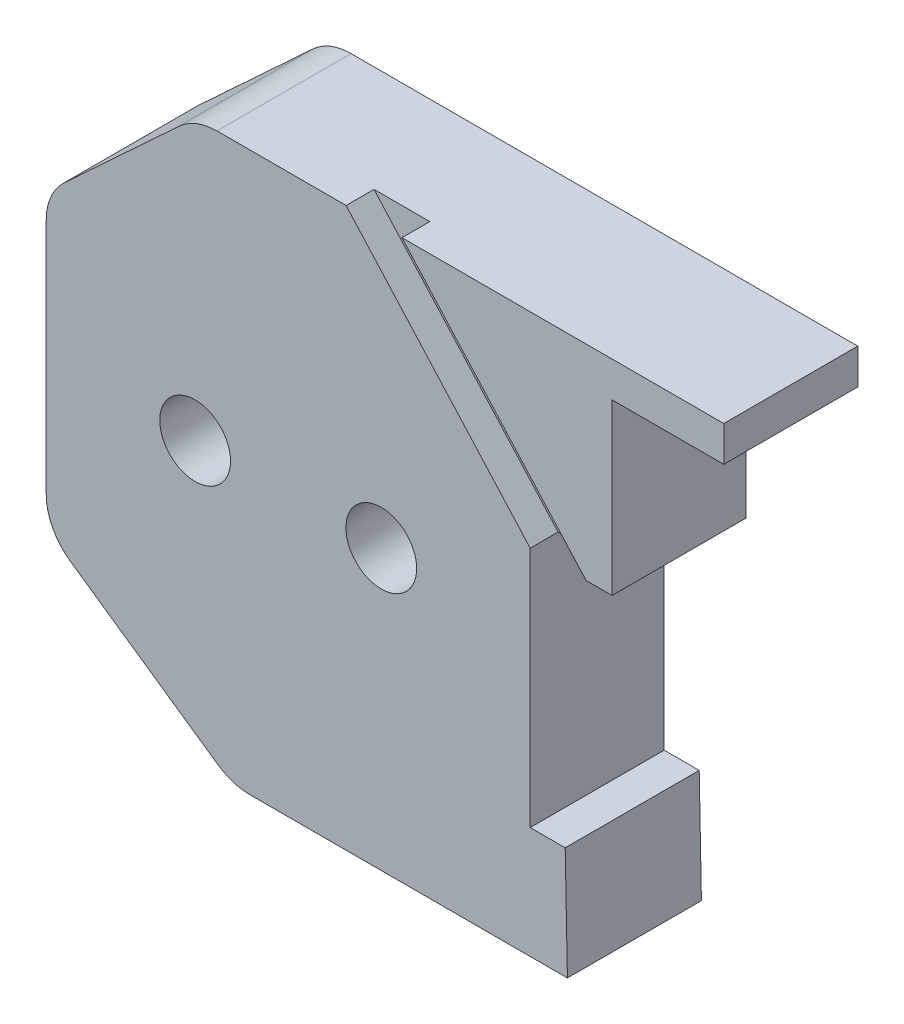
from build123d import *

# Parameters (mm, degrees)
BOSS_EXTRUDE1_DEPTH = 2
BOSS_EXTRUDE2_DEPTH = 8
SKETCH24_R          = 3.9
BOSS_EXTRUDE5_DEPTH = 4.4
SKETCH30_W          = 4.40861202
SKETCH30_H          = 1.324178481
CUT_EXTRUDE12_DEPTH = 16
CUT_EXTRUDE11_DEPTH = 23.928148639
FILLET1_R           = 1.5
SKETCH34_W          = 1.5
SKETCH34_H          = 1.5
CUT_EXTRUDE13_DEPTH = 8
SKETCH36_R          = 0.95
CUT_EXTRUDE15_DEPTH = 8
SKETCH37_R          = 2
CUT_EXTRUDE16_DEPTH = 4.5
SKETCH38_W          = 3
SKETCH38_H          = 1.25
CUT_EXTRUDE17_DEPTH = 3.6


with BuildPart() as part:
    # Sketch2 → Boss-Extrude1 (new body)
    with BuildSketch(Plane.XY):
        with BuildLine():
            Line((-2.5, 7.5), (-16.7, 7.5))
            Line((-16.7, 7.5), (-20.7, 3.793442666))
            Line((-20.7, 3.793442666), (-20.7, -4.031648778))
            Line((-20.7, -4.031648778), (-15.7, -7.5))
            Line((-15.7, -7.5), (-6.7, -7.5))
            Line((-6.7, -7.5), (-4.2, -5.6))
            ThreePointArc((-4.2, -5.6), (3.130495168, -6.260990337), (7, 0))
            ThreePointArc((7, 0), (4.949747468, 4.949747468), (0, 7))
            Line((0, 7), (0, 7.5))
            Line((0, 7.5), (-2.5, 7.5))
        make_face()
    extrude(amount=BOSS_EXTRUDE1_DEPTH)

    # Sketch4 → Boss-Extrude2 (add)
    with BuildSketch(Plane.XY.offset(2)):
        Polygon((-15.7, -7.5), (-6.7, -7.5), (-6.759079174, -4.5), (-7.7, -4.5), (-7.7, 2), (-5.5, 2), (-5.5, 5.3), (-2.5, 5.3), (-2.5, 7.5), (-16.7, 7.5), (-20.7, 3.793442666), (-20.7, -4.031648778), align=None)
    extrude(amount=BOSS_EXTRUDE2_DEPTH)

    # Sketch24 → Boss-Extrude5 (add)
    with BuildSketch(Plane.XY.offset(2)):
        Circle(SKETCH24_R)
    extrude(amount=BOSS_EXTRUDE5_DEPTH)

    # Sketch30 → Cut-Extrude12 (cut)
    with BuildSketch(Plane(origin=(-5.5, 0, 0), x_dir=(0, 0, -1), z_dir=(1, 0, 0))):
        with Locations((-4.20430601, 4.63791076)):
            Rectangle(SKETCH30_W, SKETCH30_H)
    extrude(amount=-CUT_EXTRUDE12_DEPTH, mode=Mode.SUBTRACT)

    # Sketch28 → Cut-Extrude11 (cut, through all)
    with BuildSketch(Plane.XY.offset(6.4)):
        with BuildLine():
            Line((-1, 0.979795897), (-1, -0.979795897))
            ThreePointArc((-1, -0.979795897), (1.4, 0), (-1, 0.979795897))
        make_face()
    extrude(amount=-CUT_EXTRUDE11_DEPTH, mode=Mode.SUBTRACT)

    # Fillet1
    # the kernel refuses this fillet: 1.5 mm, written as the material it takes off along each edge
    with BuildSketch(Plane(origin=(-15.230677435, -6, 1.5), x_dir=(-0.5699665637840448, -0.8216678867816415, 0), z_dir=(0, 0, -1))) as fillet1_piece_1_section:
        Polygon((0, 0), (FILLET1_R * 1.02, 0), (FILLET1_R * 1.02, -FILLET1_R * 0.319139344377), (FILLET1_R * 0.838101244517, -FILLET1_R * 0.58136589506), align=None)
    fillet1_piece_1 = extrude(amount=FILLET1_R * 1.02, mode=Mode.PRIVATE)
    fillet1_piece_1 = fillet1_piece_1 - Plane(origin=(-15.230677435, -6, 1.5), x_dir=(0.29860685961507855, 0.9543762064253388, 0), z_dir=(0, 0, -1)) * Sphere(FILLET1_R, mode=Mode.PRIVATE)
    add(fillet1_piece_1, mode=Mode.SUBTRACT)
    with BuildSketch(Plane(origin=(-16.11186344, 6, 1.5), x_dir=(-0.6796897201843015, 0.7334997506991983, 0), z_dir=(0, 0, -1))) as fillet1_piece_2_section:
        Polygon((0, 0), (FILLET1_R * 1.02, 0), (FILLET1_R * 1.02, FILLET1_R * 0.399932860855), (FILLET1_R * 0.748169745713, FILLET1_R * 0.693283514588), align=None)
    fillet1_piece_2 = extrude(amount=FILLET1_R * 1.02, mode=Mode.PRIVATE)
    fillet1_piece_2 = fillet1_piece_2 - Plane(origin=(-16.11186344, 6, 1.5), x_dir=(0.3650344157067945, -0.9309940254102596, 0), z_dir=(0, 0, -1)) * Sphere(FILLET1_R, mode=Mode.PRIVATE)
    add(fillet1_piece_2, mode=Mode.SUBTRACT)
    with BuildSketch(Plane(origin=(-19.2, 3.138411196, 1.5), x_dir=(-0.6796897201843015, 0.7334997506991983, 0), z_dir=(0, 0, -1))) as fillet1_piece_3_section:
        Polygon((0, 0), (FILLET1_R * 1.02, 0), (FILLET1_R * 1.02, -FILLET1_R * 0.445421399395), (FILLET1_R * 0.693283514588, -FILLET1_R * 0.748169745713), align=None)
    fillet1_piece_3 = extrude(amount=FILLET1_R * 1.02, mode=Mode.PRIVATE)
    fillet1_piece_3 = fillet1_piece_3 - Plane(origin=(-19.2, 3.138411196, 1.5), x_dir=(0.9164304993244992, -0.40019387789901173, 0), z_dir=(0, 0, -1)) * Sphere(FILLET1_R, mode=Mode.PRIVATE)
    add(fillet1_piece_3, mode=Mode.SUBTRACT)
    with BuildSketch(Plane(origin=(-19.2, -3.246599046, 1.5), x_dir=(-0.5699665637840448, -0.8216678867816415, 0), z_dir=(0, 0, -1))) as fillet1_piece_4_section:
        Polygon((0, 0), (FILLET1_R * 1.02, 0), (FILLET1_R * 1.02, FILLET1_R * 0.533833817771), (FILLET1_R * 0.58136589506, FILLET1_R * 0.838101244517), align=None)
    fillet1_piece_4 = extrude(amount=FILLET1_R * 1.02, mode=Mode.PRIVATE)
    fillet1_piece_4 = fillet1_piece_4 - Plane(origin=(-19.2, -3.246599046, 1.5), x_dir=(0.8859928227090906, 0.46369895202380795, 0), z_dir=(0, 0, -1)) * Sphere(FILLET1_R, mode=Mode.PRIVATE)
    add(fillet1_piece_4, mode=Mode.SUBTRACT)
    with BuildSketch(Plane(origin=(-15.230677435, -7.5, 0), x_dir=(0, 1, 0), z_dir=(1, 0, 0))) as fillet1_piece_5_section:
        with BuildLine():
            CenterArc((FILLET1_R, FILLET1_R), FILLET1_R, 180, 90)
            Line((0, FILLET1_R), (0, 0))
            Line((0, 0), (FILLET1_R, 0))
        make_face()
    fillet1_piece_5 = extrude(amount=12.280677435, mode=Mode.PRIVATE)
    fillet1_piece_5 = split(fillet1_piece_5, bisect_by=Plane(origin=(-9.092127217, -9.318016685, 0.3282266), z_dir=(-0.6050832675335577, 0.7961621941231027, 0)), keep=Keep.TOP, mode=Mode.PRIVATE)
    add(fillet1_piece_5, mode=Mode.SUBTRACT)
    with BuildSketch(Plane(origin=(3.75, 7.5, 0), x_dir=(0, 0, 1), z_dir=(-1, 0, 0))) as fillet1_piece_6:
        with BuildLine():
            CenterArc((FILLET1_R, -FILLET1_R), FILLET1_R, 90, 90)
            Line((0, -FILLET1_R), (0, 0))
            Line((0, 0), (FILLET1_R, 0))
        make_face()
    extrude(amount=19.86186344, mode=Mode.SUBTRACT)
    with BuildSketch(Plane(origin=(-17.13139802, 7.100249626, 0), x_dir=(0.6796897201843014, -0.7334997506991981, 0), z_dir=(-0.7334997506991983, -0.6796897201843015, 0))) as fillet1_piece_7:
        with BuildLine():
            CenterArc((FILLET1_R, FILLET1_R), FILLET1_R, 180, 90)
            Line((0, FILLET1_R), (0, 0))
            Line((0, 0), (FILLET1_R, 0))
        make_face()
    extrude(amount=4.21013989, mode=Mode.SUBTRACT)
    with BuildSketch(Plane(origin=(-20.054949846, -4.479100876, 0), x_dir=(0.5699665637840448, 0.8216678867816416, 0), z_dir=(0.8216678867816415, -0.5699665637840448, 0))) as fillet1_piece_8:
        with BuildLine():
            CenterArc((FILLET1_R, FILLET1_R), FILLET1_R, 180, 90)
            Line((0, FILLET1_R), (0, 0))
            Line((0, 0), (FILLET1_R, 0))
        make_face()
    extrude(amount=4.830811364, mode=Mode.SUBTRACT)
    with BuildSketch(Plane(origin=(-20.7, 3.138411196, 0), x_dir=(1, 0, 0), z_dir=(0, -1, 0))) as fillet1_piece_9:
        with BuildLine():
            CenterArc((FILLET1_R, FILLET1_R), FILLET1_R, 180, 90)
            Line((0, FILLET1_R), (0, 0))
            Line((0, 0), (FILLET1_R, 0))
        make_face()
    extrude(amount=6.385010242, mode=Mode.SUBTRACT)
    with BuildSketch(Plane(origin=(-15.7, -7.5, 1.5), x_dir=(1, 0, 0), z_dir=(0, 0, 1))) as fillet1_piece_10:
        with BuildLine():
            CenterArc((FILLET1_R * 0.312881710173, FILLET1_R), FILLET1_R, 235.252105822, 34.747894178)
            Line((-FILLET1_R * 0.257084853611, FILLET1_R * 0.178332113218), (0, 0))
            Line((0, 0), (FILLET1_R * 0.312881710173, 0))
        make_face()
    extrude(amount=9.673306413, mode=Mode.SUBTRACT)
    with BuildSketch(Plane(origin=(-20.7, -4.031648778, 1.5), x_dir=(0, 1, 0), z_dir=(0, 0, 1))) as fillet1_piece_11:
        with BuildLine():
            CenterArc((FILLET1_R * 0.523366488011, -FILLET1_R), FILLET1_R, 90, 55.252105822)
            Line((-FILLET1_R * 0.298301398771, -FILLET1_R * 0.430033436216), (0, 0))
            Line((0, 0), (FILLET1_R * 0.523366488011, 0))
        make_face()
    extrude(amount=10.46262433, mode=Mode.SUBTRACT)
    with BuildSketch(Plane(origin=(-20.7, 3.793442666, 1.5), x_dir=(0.7334997506991984, 0.6796897201843014, 0), z_dir=(0, 0, 1))) as fillet1_piece_12:
        with BuildLine():
            CenterArc((FILLET1_R * 0.436687646465, -FILLET1_R), FILLET1_R, 90, 47.18059856)
            Line((-FILLET1_R * 0.296812104234, -FILLET1_R * 0.320310279816), (0, 0))
            Line((0, 0), (FILLET1_R * 0.436687646465, 0))
        make_face()
    extrude(amount=10.137578674, mode=Mode.SUBTRACT)
    with BuildSketch(Plane(origin=(-16.7, 7.5, 1.5), x_dir=(1, 0, 0), z_dir=(0, 0, 1))) as fillet1_piece_13:
        with BuildLine():
            CenterArc((FILLET1_R * 0.392091040054, -FILLET1_R), FILLET1_R, 90, 42.81940144)
            Line((-FILLET1_R * 0.287598680131, -FILLET1_R * 0.266500249301), (0, 0))
            Line((0, 0), (FILLET1_R * 0.392091040054, 0))
        make_face()
    extrude(amount=9.9703414, mode=Mode.SUBTRACT)

    # Sketch34 → Cut-Extrude13 (cut, along a direction that is not the sketch's normal)
    with BuildSketch(Plane.XZ.offset(-2)):
        with Locations((-6.95, 10)):
            Rectangle(SKETCH34_W, SKETCH34_H)
    extrude(amount=-CUT_EXTRUDE13_DEPTH, dir=(0.6685833876565112, -0.7436371788377336, 0), mode=Mode.SUBTRACT)

    # Sketch36 → Cut-Extrude15 (cut)
    with BuildSketch(Plane.XY.offset(10)):
        with Locations((-11.7, 0)):
            Circle(SKETCH36_R)
        with Locations((-16.7, 0)):
            Circle(SKETCH36_R)
    extrude(amount=-CUT_EXTRUDE15_DEPTH, mode=Mode.SUBTRACT)

    # Sketch37 → Cut-Extrude16 (cut)
    with BuildSketch(Plane(origin=(0, 0, 0), x_dir=(-1, 0, 0), z_dir=(0, 0, -1))):
        with Locations((11.7, 0)):
            Circle(SKETCH37_R)
        with Locations((16.7, 0)):
            Circle(SKETCH37_R)
    extrude(amount=-CUT_EXTRUDE16_DEPTH, mode=Mode.SUBTRACT)

    # Sketch38 → Cut-Extrude17 (cut)
    with BuildSketch(Plane.XY.offset(10)):
        with Locations((-4, 5.925)):
            Rectangle(SKETCH38_W, SKETCH38_H)
    extrude(amount=-CUT_EXTRUDE17_DEPTH, mode=Mode.SUBTRACT)


with BuildPart() as body_2:
    # Split1: the piece on the far side of the plane
    add(part.part)
    split(bisect_by=Plane.XY.offset(6.4), keep=Keep.BOTTOM)


with BuildPart() as part_1:
    add(part.part)

    # Split1
    split(bisect_by=Plane.XY.offset(6.4), keep=Keep.TOP)


solid = part_1.part
